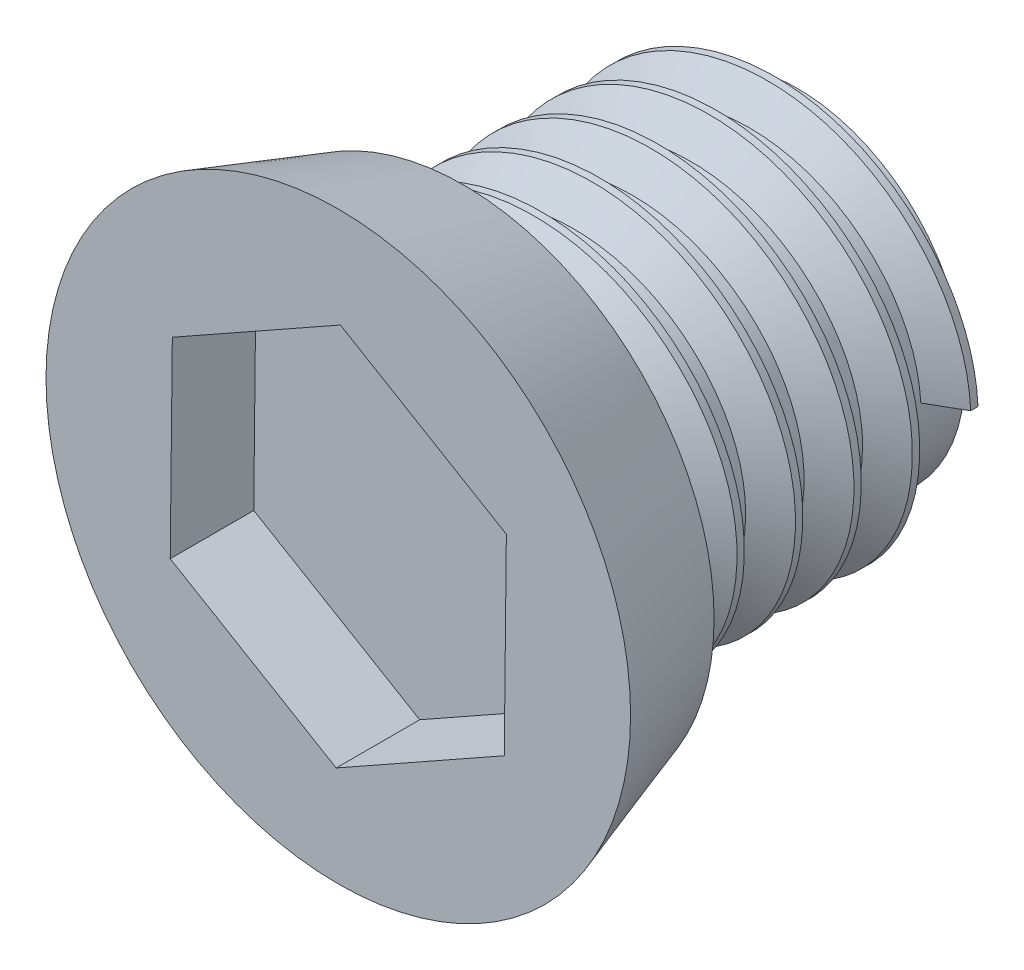
from build123d import *

# Parameters (mm, degrees)
SKETCH1_R           = 2
BOSS_EXTRUDE1_DEPTH = 4
SKETCH4_R           = 3
SKETCH3_R           = 3.5
THREAD1_PITCH       = 0.7
CUT_EXTRUDE1_DEPTH  = 1


with BuildPart() as part:
    # Sketch1 → Boss-Extrude1 (new body)
    with BuildSketch(Plane.XY):
        Circle(SKETCH1_R)
    extrude(amount=BOSS_EXTRUDE1_DEPTH)

    # Sketch4 → Loft2 section 0
    with BuildSketch(Plane.XY.offset(4)):
        Circle(SKETCH4_R)
    # Sketch3 → Loft2 section 1
    with BuildSketch(Plane.XY.offset(5.5)):
        Circle(SKETCH3_R)
    loft()

    # Thread1: the profile of Thread Profile1 profile screwed along a right-hand helix of 5.714286 turns, 6 arcs to a turn; built about Z, then put on its axis
    thread1_z = Axis((0, 0, 0), (0, 0, 1))
    thread1_corners = [(1.9997, 0, -0.000173205), (2.378886113, 0, 0.218749999), (2.378886113, 0, 0.306249999), (1.9997, 0, 0.525173203)]
    with BuildLine(mode=Mode.PRIVATE) as thread1_profile:
        Line(thread1_corners[0], thread1_corners[1])
        Line(thread1_corners[1], thread1_corners[2])
        Line(thread1_corners[2], thread1_corners[3])
        Line(thread1_corners[3], thread1_corners[0])
    thread1_cap = Face(thread1_profile.wire())
    thread1_turn_angles = [0, 30, 60, 90, 120, 150, 180, 210, 240, 270, 300, 330, 360]
    thread1_turn_weights = [1, 0.8660254037844387, 1, 0.8660254037844387, 1, 0.8660254037844387, 1, 0.8660254037844387, 1, 0.8660254037844387, 1, 0.8660254037844387, 1]
    thread1_turn_rails = [Edge.make_bspline([Vector(p[0], p[1], 0).rotate(thread1_z, thread1_turn_angles[k]) / thread1_turn_weights[k] + Vector(0, 0, p[2] + THREAD1_PITCH * thread1_turn_angles[k] / 360) for k in range(13)], [0, 0, 0, 1, 1, 2, 2, 3, 3, 4, 4, 5, 5, 6, 6, 6], 2, thread1_turn_weights) for p in thread1_corners]
    thread1_turn_sides = [Face.make_surface_from_curves(thread1_turn_rails[p[0]], thread1_turn_rails[p[1]]) for p in [(0, 1), (1, 2), (2, 3), (3, 0)]]
    thread1_last_angles = [1800, 1830, 1860, 1890, 1920, 1950, 1980, 2010, 2040, 2048.571428571, 2057.142857143]
    thread1_last_weights = [1, 0.8660254037844387, 1, 0.8660254037844387, 1, 0.8660254037844387, 1, 0.8660254037844387, 1, 0.9888308262251283, 1]
    thread1_last_rails = [Edge.make_bspline([Vector(p[0], p[1], 0).rotate(thread1_z, thread1_last_angles[k]) / thread1_last_weights[k] + Vector(0, 0, p[2] + THREAD1_PITCH * thread1_last_angles[k] / 360) for k in range(11)], [0, 0, 0, 1, 1, 2, 2, 3, 3, 4, 4, 5, 5, 5], 2, thread1_last_weights) for p in thread1_corners]
    thread1_last_sides = [Face.make_surface_from_curves(thread1_last_rails[p[0]], thread1_last_rails[p[1]]) for p in [(0, 1), (1, 2), (2, 3), (3, 0)]]
    thread1 = Plane(origin=(0, 0, 0), x_dir=(1, 0, 0), z_dir=(0, 0, 1)) * Solid(Shell([*[p.moved(Location((0, 0, THREAD1_PITCH * i))) for i in range(5) for p in thread1_turn_sides], *thread1_last_sides, thread1_cap, thread1_cap.rotate(thread1_z, 2057.142857143).moved(Location((0, 0, THREAD1_PITCH * 2057.142857143 / 360)))]))
    add(thread1)

    # Sketch7 → Cut-Extrude1 (cut)
    with BuildSketch(Plane.XY.offset(5.5)):
        Polygon((2.012440257, 1.132880199), (0.025117097, 2.309264486), (-1.98732316, 1.176384287), (-2.012440257, -1.132880199), (-0.025117097, -2.309264486), (1.98732316, -1.176384287), align=None)
    extrude(amount=-CUT_EXTRUDE1_DEPTH, mode=Mode.SUBTRACT)


solid = part.part
